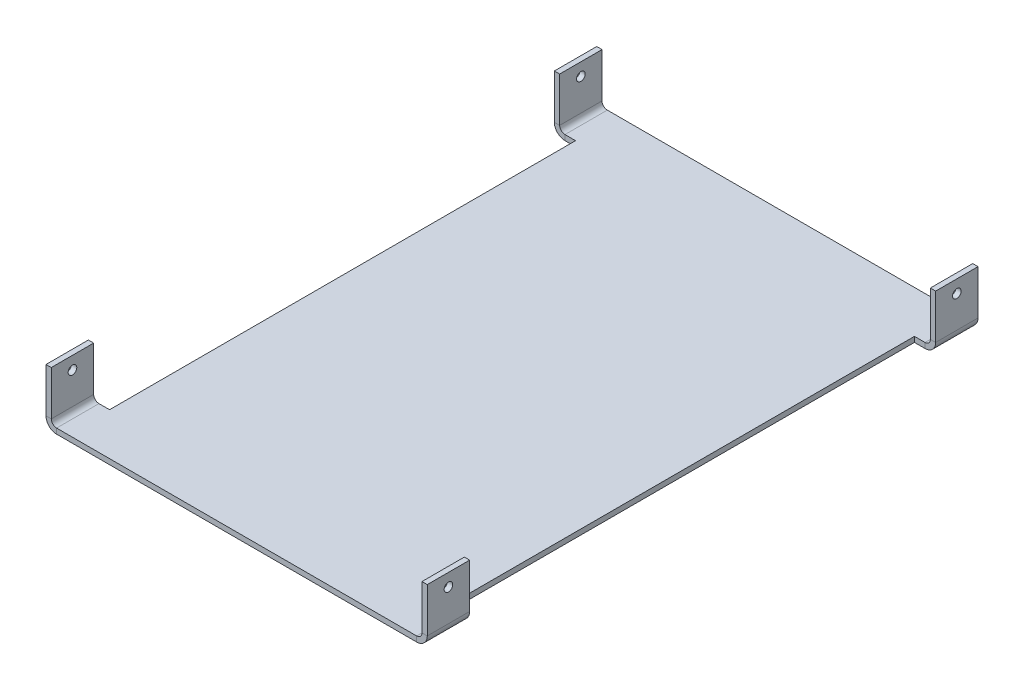
from build123d import *

# Parameters (mm, degrees)
BASE_FLANGE1_DEPTH      = 330.2
SKETCH21_R              = 2.5796875
CUT_EXTRUDE1_DEPTH      = 403.964415799
CUT_EXTRUDE2_DEPTH      = 403.716679596
CUT_EXTRUDE2_DEPTH_BACK = 403.716679596
SKETCH22_W              = 50.8
SKETCH22_H              = 279.4


# Sheet-metal steps are written as plain solids
with BuildPart() as part:
    # Sketch7 → Base-Flange1 (new body)
    with BuildSketch(Plane.XY):
        with BuildLine():
            Line((-228.6, 33.02), (-228.6, 6.35))
            ThreePointArc((-228.6, 6.35), (-226.740128061, 1.859871939), (-222.25, 0))
            Line((-222.25, 0), (-6.35, 0))
            ThreePointArc((-6.35, 0), (-1.859871939, 1.859871939), (0, 6.35))
            Line((0, 6.35), (0, 33.02))
            Line((0, 33.02), (-3.175, 33.02))
            Line((-3.175, 33.02), (-3.175, 6.35))
            ThreePointArc((-3.175, 6.35), (-4.10493597, 4.10493597), (-6.35, 3.175))
            Line((-6.35, 3.175), (-222.25, 3.175))
            ThreePointArc((-222.25, 3.175), (-224.49506403, 4.10493597), (-225.425, 6.35))
            Line((-225.425, 6.35), (-225.425, 33.02))
            Line((-225.425, 33.02), (-228.6, 33.02))
        make_face()
    extrude(amount=BASE_FLANGE1_DEPTH)

    # Sketch21 → Cut-Extrude1 (cut, through all)
    with BuildSketch(Plane.ZY.offset(228.6)):
        with Locations((12.7, 25.4)):
            Circle(SKETCH21_R)
        with Locations((317.5, 25.4)):
            Circle(SKETCH21_R)
    extrude(amount=-CUT_EXTRUDE1_DEPTH, mode=Mode.SUBTRACT)

    # Sketch22 → Cut-Extrude2 (cut, two sides: drawn at the far end of the back side and taken through both)
    with BuildSketch(Plane(origin=(0, 3.175, 0), x_dir=(1, 0, 0), z_dir=(0, 1, 0)).offset(-CUT_EXTRUDE2_DEPTH_BACK)):
        with Locations((-241.3, -165.1)):
            Rectangle(SKETCH22_W, SKETCH22_H)
        with Locations((12.7, -165.1)):
            Rectangle(SKETCH22_W, SKETCH22_H)
    extrude(amount=CUT_EXTRUDE2_DEPTH + CUT_EXTRUDE2_DEPTH_BACK, mode=Mode.SUBTRACT)


solid = part.part
